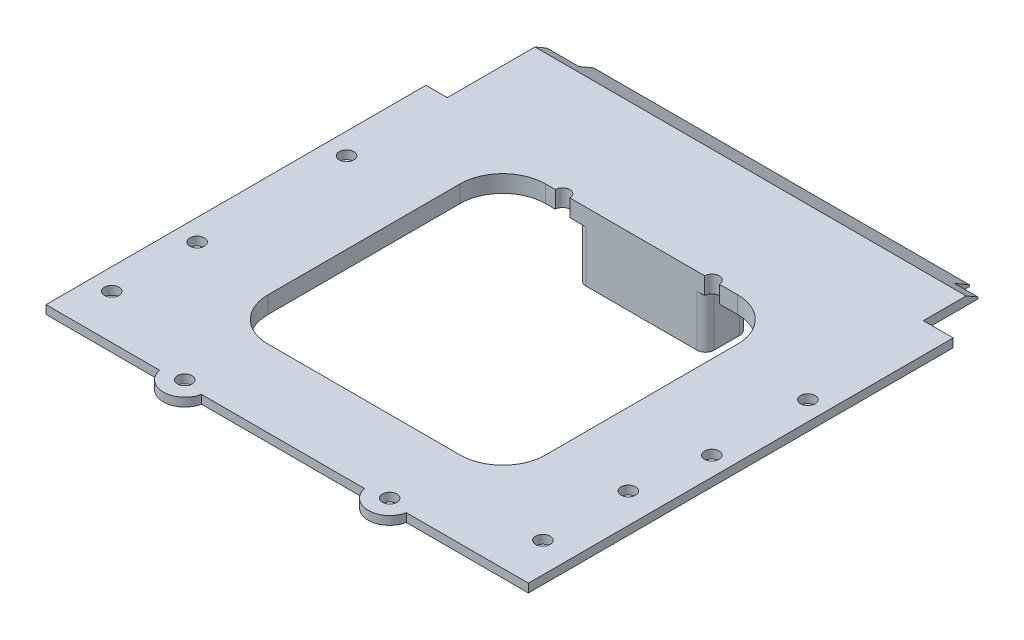
from build123d import *

# Parameters (mm, degrees)
SKETCH_1_W               = 113
SKETCH_1_H               = 113
EXTRUDE_1_DEPTH          = 3
CUT_EXTRUDE_1_REACH      = 161.834
SKETCH_2_R               = 1.7
SKETCH_3_W               = 90
SKETCH_3_H               = 105
EXTRUDE_2_DEPTH          = 2
SKETCH_5_R               = 5
EXTRUDE_3_DEPTH          = 3
CUT_EXTRUDE_2_REACH      = 161.834
SKETCH_6_R               = 1.7
CUT_EXTRUDE_3_REACH      = 161.834
SKETCH_7_R               = 1.7
CUT_EXTRUDE_4_REACH      = 161.884
SKETCH_8_R               = 1.7
EXTRUDE_5_DEPTH          = 90
CUT_EXTRUDE_5_DEPTH      = 2
SKETCH_13_W              = 2
SKETCH_13_H              = 12
EXTRUDE_6_DEPTH          = 11.5
CUT_EXTRUDE_6_REACH      = 162.612
SKETCH_14_R              = 1.7
CUT_EXTRUDE_7_REACH      = 164.681
EXTRUDE_7_DEPTH          = 8.5
SKETCH_17_W              = 2
SKETCH_17_H              = 11.5
EXTRUDE_8_DEPTH          = 3
FILLET_1_R               = 1
CUT_EXTRUDE_8_DEPTH      = 163.681089759
SKETCH_20_W              = 113
SKETCH_20_H              = 12.124355653
CUT_EXTRUDE_9_DEPTH      = 1
CHAMFER_1_SIZE           = 1
SKETCH_21_W              = 7
SKETCH_21_H              = 13.5
CUT_EXTRUDE_10_DEPTH     = 163.681089759
SKETCH_22_W              = 5
SKETCH_22_H              = 24
CUT_EXTRUDE_11_DEPTH     = 163.681089759
SKETCH_23_W              = 2
SKETCH_23_H              = 19.464101615
CUT_EXTRUDE_12_DEPTH     = 2
CUT_EXTRUDE_START        = -2
CUT_EXTRUDE_13_OUTLINE_W = 93
CUT_EXTRUDE_13_OUTLINE_H = 1.228718708
CUT_EXTRUDE_13_DEPTH     = 2
SKETCH_25_W              = 0.692820323
SKETCH_25_H              = 0.4
CUT_EXTRUDE_14_DEPTH     = 5.5
SKETCH_26_W              = 0.692820323
SKETCH_26_H              = 0.4
CUT_EXTRUDE_15_DEPTH     = 7.5
SKETCH_27_W              = 113
SKETCH_27_H              = 105.875644347
CUT_EXTRUDE_16_DEPTH     = 163.339889035
SKETCH_29_W              = 10
SKETCH_29_H              = 5
CUT_EXTRUDE_17_DEPTH     = 163.185818036
SKETCH_30_W              = 10
SKETCH_30_H              = 2
CUT_EXTRUDE_18_DEPTH     = 37
SKETCH_31_W              = 10
SKETCH_31_H              = 27
EXTRUDE_9_DEPTH          = 1
CUT_EXTRUDE_19_REACH     = 164.056
SKETCH_32_W              = 65
SKETCH_32_H              = 65
SKETCH_33_W              = 30
SKETCH_33_H              = 10
EXTRUDE_10_DEPTH         = 12
EXTRUDE_11_DEPTH         = 12
EXTRUDE_START            = -4
EXTRUDE_11_2_OUTLINE_W   = 10
EXTRUDE_11_2_OUTLINE_H   = 7
EXTRUDE_11_2_DEPTH       = 4


# Read off the part's stored shape, not the designer's step: 切除-拉伸13, 凸台-拉伸11
with BuildPart() as part:
    # 草图1 → 凸台-拉伸1 (new body)
    with BuildSketch(Plane(origin=(0, 0, 0), x_dir=(1, 0, 0), z_dir=(0, 1, 0))):
        with Locations((56.5, 56.5)):
            Rectangle(SKETCH_1_W, SKETCH_1_H)
    extrude(amount=EXTRUDE_1_DEPTH)

    # 草图2 → 切除-拉伸1 (cut, up to next)
    with BuildSketch(Plane(origin=(0, 3, 0), x_dir=(1, 0, 0), z_dir=(0, 1, 0)), mode=Mode.PRIVATE) as cut_extrude_1_sk1:
        with Locations(Location((108.5, 69.95, 0), (0, 0, 270))):
            Circle(SKETCH_2_R)
    cut_extrude_1_tool1 = extrude(cut_extrude_1_sk1.sketch, amount=-CUT_EXTRUDE_1_REACH, mode=Mode.PRIVATE) & part.part
    # 草图2 → 切除-拉伸1 (cut, up to next)
    with BuildSketch(Plane(origin=(0, 3, 0), x_dir=(1, 0, 0), z_dir=(0, 1, 0)), mode=Mode.PRIVATE) as cut_extrude_1_sk2:
        with Locations(Location((108.5, 47.45, 0), (0, 0, 270))):
            Circle(SKETCH_2_R)
    cut_extrude_1_tool2 = extrude(cut_extrude_1_sk2.sketch, amount=-CUT_EXTRUDE_1_REACH, mode=Mode.PRIVATE) & part.part
    # 草图2 → 切除-拉伸1 (cut, up to next)
    with BuildSketch(Plane(origin=(0, 3, 0), x_dir=(1, 0, 0), z_dir=(0, 1, 0)), mode=Mode.PRIVATE) as cut_extrude_1_sk3:
        with Locations(Location((106, 30.4, 0), (0, 0, 270))):
            Circle(SKETCH_2_R)
    cut_extrude_1_tool3 = extrude(cut_extrude_1_sk3.sketch, amount=-CUT_EXTRUDE_1_REACH, mode=Mode.PRIVATE) & part.part
    # 草图2 → 切除-拉伸1 (cut, up to next)
    with BuildSketch(Plane(origin=(0, 3, 0), x_dir=(1, 0, 0), z_dir=(0, 1, 0)), mode=Mode.PRIVATE) as cut_extrude_1_sk4:
        with Locations(Location((106, 10.4, 0), (0, 0, 270))):
            Circle(SKETCH_2_R)
    cut_extrude_1_tool4 = extrude(cut_extrude_1_sk4.sketch, amount=-CUT_EXTRUDE_1_REACH, mode=Mode.PRIVATE) & part.part
    add(cut_extrude_1_tool1.solids().sort_by_distance((108.5, 3, -69.95))[0], mode=Mode.SUBTRACT)
    add(cut_extrude_1_tool2.solids().sort_by_distance((108.5, 3, -47.45))[0], mode=Mode.SUBTRACT)
    add(cut_extrude_1_tool3.solids().sort_by_distance((106, 3, -30.4))[0], mode=Mode.SUBTRACT)
    add(cut_extrude_1_tool4.solids().sort_by_distance((106, 3, -10.4))[0], mode=Mode.SUBTRACT)

    # 草图3 → 凸台-拉伸2 (add)
    with BuildSketch(Plane(origin=(0, 0, 0), x_dir=(1, 0, 0), z_dir=(0, 1, 0))):
        with Locations((55.5, 60.5)):
            Rectangle(SKETCH_3_W, SKETCH_3_H)
    extrude(amount=-EXTRUDE_2_DEPTH)

    # 草图5 → 凸台-拉伸3 (add)
    with BuildSketch(Plane.XZ):
        with Locations((79.5, -1)):
            Circle(SKETCH_5_R)
        with Locations((31.5, -1)):
            Circle(SKETCH_5_R)
    extrude(amount=-EXTRUDE_3_DEPTH)

    # 草图6 → 切除-拉伸2 (cut, up to next)
    with BuildSketch(Plane.XZ, mode=Mode.PRIVATE) as cut_extrude_2_sk1:
        with Locations(Location((31.5, -1, 0), (0, 0, 270))):
            Circle(SKETCH_6_R)
    cut_extrude_2_tool1 = extrude(cut_extrude_2_sk1.sketch, amount=-CUT_EXTRUDE_2_REACH, mode=Mode.PRIVATE) & part.part
    # 草图6 → 切除-拉伸2 (cut, up to next)
    with BuildSketch(Plane.XZ, mode=Mode.PRIVATE) as cut_extrude_2_sk2:
        with Locations(Location((79.5, -1, 0), (0, 0, 270))):
            Circle(SKETCH_6_R)
    cut_extrude_2_tool2 = extrude(cut_extrude_2_sk2.sketch, amount=-CUT_EXTRUDE_2_REACH, mode=Mode.PRIVATE) & part.part
    add(cut_extrude_2_tool1.solids().sort_by_distance((31.5, 0, -1))[0], mode=Mode.SUBTRACT)
    add(cut_extrude_2_tool2.solids().sort_by_distance((79.5, 0, -1))[0], mode=Mode.SUBTRACT)

    # 草图7 → 切除-拉伸3 (cut, up to next)
    with BuildSketch(Plane.XZ, mode=Mode.PRIVATE) as cut_extrude_3_sk1:
        with Locations(Location((5, -10.4, 0), (0, 0, 270))):
            Circle(SKETCH_7_R)
    cut_extrude_3_tool1 = extrude(cut_extrude_3_sk1.sketch, amount=-CUT_EXTRUDE_3_REACH, mode=Mode.PRIVATE) & part.part
    # 草图7 → 切除-拉伸3 (cut, up to next)
    with BuildSketch(Plane.XZ, mode=Mode.PRIVATE) as cut_extrude_3_sk2:
        with Locations(Location((5, -30.4, 0), (0, 0, 270))):
            Circle(SKETCH_7_R)
    cut_extrude_3_tool2 = extrude(cut_extrude_3_sk2.sketch, amount=-CUT_EXTRUDE_3_REACH, mode=Mode.PRIVATE) & part.part
    # 草图7 → 切除-拉伸3 (cut, up to next)
    with BuildSketch(Plane.XZ, mode=Mode.PRIVATE) as cut_extrude_3_sk3:
        with Locations(Location((5, -65.4, 0), (0, 0, 270))):
            Circle(SKETCH_7_R)
    cut_extrude_3_tool3 = extrude(cut_extrude_3_sk3.sketch, amount=-CUT_EXTRUDE_3_REACH, mode=Mode.PRIVATE) & part.part
    add(cut_extrude_3_tool1.solids().sort_by_distance((5, 0, -10.4))[0], mode=Mode.SUBTRACT)
    add(cut_extrude_3_tool2.solids().sort_by_distance((5, 0, -30.4))[0], mode=Mode.SUBTRACT)
    add(cut_extrude_3_tool3.solids().sort_by_distance((5, 0, -65.4))[0], mode=Mode.SUBTRACT)

    # 草图8 → 切除-拉伸4 (cut, up to next)
    with BuildSketch(Plane.XZ.offset(2), mode=Mode.PRIVATE) as cut_extrude_4_sk1:
        with Locations(Location((38, -83, 0), (0, 0, 270))):
            Circle(SKETCH_8_R)
    cut_extrude_4_tool1 = extrude(cut_extrude_4_sk1.sketch, amount=-CUT_EXTRUDE_4_REACH, mode=Mode.PRIVATE) & part.part
    # 草图8 → 切除-拉伸4 (cut, up to next)
    with BuildSketch(Plane.XZ.offset(2), mode=Mode.PRIVATE) as cut_extrude_4_sk2:
        with Locations(Location((73, -83, 0), (0, 0, 270))):
            Circle(SKETCH_8_R)
    cut_extrude_4_tool2 = extrude(cut_extrude_4_sk2.sketch, amount=-CUT_EXTRUDE_4_REACH, mode=Mode.PRIVATE) & part.part
    add(cut_extrude_4_tool1.solids().sort_by_distance((38, -2, -83))[0], mode=Mode.SUBTRACT)
    add(cut_extrude_4_tool2.solids().sort_by_distance((73, -2, -83))[0], mode=Mode.SUBTRACT)

    # 草图10 → 凸台-拉伸5 (add)
    with BuildSketch(Plane(origin=(100.5, 0, 0), x_dir=(0, 0, -1), z_dir=(1, 0, 0))):
        Polygon((113, 0), (116.464101615, -2), (113, -2), align=None)
    extrude(amount=-EXTRUDE_5_DEPTH)

    # 草图11 → 切除-拉伸5 (cut)
    with BuildSketch(Plane(origin=(0, -2, 0), x_dir=(1, 0, 0), z_dir=(0, 1, 0))):
        with BuildLine():
            Line((33, 83), (33, 53))
            ThreePointArc((33, 53), (38, 48), (43, 53))
            Line((43, 53), (43, 83))
            ThreePointArc((43, 83), (38, 88), (33, 83))
        make_face()
        with BuildLine():
            Line((68, 83), (68, 53))
            ThreePointArc((68, 53), (73, 48), (78, 53))
            Line((78, 53), (78, 83))
            ThreePointArc((78, 83), (73, 88), (68, 83))
        make_face()
    extrude(amount=CUT_EXTRUDE_5_DEPTH, mode=Mode.SUBTRACT)

    # 草图13 → 凸台-拉伸6 (add)
    with BuildSketch(Plane.XZ):
        with Locations((4, -83)):
            Rectangle(SKETCH_13_W, SKETCH_13_H)
    extrude(amount=EXTRUDE_6_DEPTH)

    # 草图14 → 切除-拉伸6 (cut, up to next)
    with BuildSketch(Plane.ZY.offset(-3), mode=Mode.PRIVATE) as cut_extrude_6_sk1:
        with Locations((-83.5, -5)):
            Circle(SKETCH_14_R)
    cut_extrude_6_tool1 = extrude(cut_extrude_6_sk1.sketch, amount=-CUT_EXTRUDE_6_REACH, mode=Mode.PRIVATE) & part.part
    add(cut_extrude_6_tool1.solids().sort_by_distance((3, -5, -83.5))[0], mode=Mode.SUBTRACT)

    # 草图15 → 切除-拉伸7 (cut, up to next)
    with BuildSketch(Plane.XZ, mode=Mode.PRIVATE) as cut_extrude_7_sk1:
        Polygon((113, -100.875644347), (106, -113), (113, -113), align=None)
    cut_extrude_7_tool1 = extrude(cut_extrude_7_sk1.sketch, amount=-CUT_EXTRUDE_7_REACH, mode=Mode.PRIVATE) & part.part
    add(cut_extrude_7_tool1.solids().sort_by_distance((110.666667, 0, -108.958548))[0], mode=Mode.SUBTRACT)

    # 草图16 → 凸台-拉伸7 (add)
    with BuildSketch(Plane.XZ):
        Polygon((113, -99.5), (107.5, -99.5), (107.5, -110.401923789), (113, -100.875644347), align=None)
    extrude(amount=EXTRUDE_7_DEPTH)

    # 草图17 → 凸台-拉伸8 (add)
    with BuildSketch(Plane.ZY.offset(-3)):
        with Locations((-78, -5.75)):
            Rectangle(SKETCH_17_W, SKETCH_17_H)
    extrude(amount=EXTRUDE_8_DEPTH)

    # 圆角1
    fillet_1_edges = [part.edges().sort_by_distance(p)[0] for p in [
        (3, -5.75, -79),
    ]]
    fillet(fillet_1_edges, radius=FILLET_1_R)

    # 草图19 → 切除-拉伸8 (cut, through all)
    with BuildSketch(Plane.ZY):
        Polygon((-113, 0), (-107.803847577, 3), (-113, 3), align=None)
    extrude(amount=-CUT_EXTRUDE_8_DEPTH, mode=Mode.SUBTRACT)

    # 草图20 → 切除-拉伸9 (cut)
    with BuildSketch(Plane(origin=(0, 3, 0), x_dir=(1, 0, 0), z_dir=(0, 1, 0))):
        with Locations((56.5, 106.937822173)):
            Rectangle(SKETCH_20_W, SKETCH_20_H)
    extrude(amount=-CUT_EXTRUDE_9_DEPTH, mode=Mode.SUBTRACT)

    # 倒角1
    chamfer_1_edges = [part.edges().sort_by_distance(p)[0] for p in [
        (56.5, 2, -100.875644347),
    ]]
    chamfer(chamfer_1_edges, length=CHAMFER_1_SIZE - 0.0001)  # a hair under: the kernel refuses the full size

    # 草图21 → 切除-拉伸10 (cut, through all)
    with BuildSketch(Plane.XZ.offset(8.5)):
        with Locations((109.5, -106.25)):
            Rectangle(SKETCH_21_W, SKETCH_21_H)
    extrude(amount=-CUT_EXTRUDE_10_DEPTH, mode=Mode.SUBTRACT)

    # 草图22 → 切除-拉伸11 (cut, through all)
    with BuildSketch(Plane.XZ):
        with Locations((2.5, -101)):
            Rectangle(SKETCH_22_W, SKETCH_22_H)
    extrude(amount=-CUT_EXTRUDE_11_DEPTH, mode=Mode.SUBTRACT)

    # 草图23 → 切除-拉伸12 (cut)
    with BuildSketch(Plane.XZ.offset(2)):
        with Locations((11.5, -106.732050808)):
            Rectangle(SKETCH_23_W, SKETCH_23_H)
    extrude(amount=-CUT_EXTRUDE_12_DEPTH, mode=Mode.SUBTRACT)

    # 切除-拉伸13 outline → 切除-拉伸13 (cut)
    with BuildSketch(Plane(origin=(0, 0, 0), x_dir=(1, 0, 0), z_dir=(0, 1, 0)).offset(CUT_EXTRUDE_START)):
        Polygon((9.5, 94), (12.5, 97), (9, 97), (9, 94), align=None)
        with Locations((55.5, 116.385640646)):
            Rectangle(CUT_EXTRUDE_13_OUTLINE_W, CUT_EXTRUDE_13_OUTLINE_H)
    extrude(amount=CUT_EXTRUDE_13_DEPTH, mode=Mode.SUBTRACT)

    # 草图25 → 切除-拉伸14 (cut)
    with BuildSketch(Plane(origin=(106, 0, 0), x_dir=(0, 0, -1), z_dir=(1, 0, 0))):
        with Locations((112.653589839, 0.2)):
            Rectangle(SKETCH_25_W, SKETCH_25_H)
    extrude(amount=-CUT_EXTRUDE_14_DEPTH, mode=Mode.SUBTRACT)

    # 草图26 → 切除-拉伸15 (cut)
    with BuildSketch(Plane.ZY.offset(-5)):
        with Locations((-112.653589839, 0.2)):
            Rectangle(SKETCH_26_W, SKETCH_26_H)
    extrude(amount=-CUT_EXTRUDE_15_DEPTH, mode=Mode.SUBTRACT)

    # 草图27 → 切除-拉伸16 (cut, through all)
    with BuildSketch(Plane(origin=(0, 2, 0), x_dir=(1, 0, 0), z_dir=(0, 1, 0))):
        with Locations((56.5, 48.937822174)):
            Rectangle(SKETCH_27_W, SKETCH_27_H)
    extrude(amount=CUT_EXTRUDE_16_DEPTH, mode=Mode.SUBTRACT)

    # 草图29 → 切除-拉伸17 (cut, through all)
    with BuildSketch(Plane.XZ):
        with Locations((38, -50.5)):
            Rectangle(SKETCH_29_W, SKETCH_29_H)
        with Locations((73, -50.5)):
            Rectangle(SKETCH_29_W, SKETCH_29_H)
    extrude(amount=CUT_EXTRUDE_17_DEPTH, mode=Mode.SUBTRACT)

    # 草图30 → 切除-拉伸18 (cut)
    with BuildSketch(Plane(origin=(0, 0, -48), x_dir=(-1, 0, 0), z_dir=(0, 0, -1))):
        with Locations((-38, -1)):
            Rectangle(SKETCH_30_W, SKETCH_30_H)
        with Locations((-73, -1)):
            Rectangle(SKETCH_30_W, SKETCH_30_H)
    extrude(amount=-CUT_EXTRUDE_18_DEPTH, mode=Mode.SUBTRACT)

    # 草图31 → 凸台-拉伸9 (add)
    with BuildSketch(Plane.XZ):
        with Locations((38, -24.5)):
            Rectangle(SKETCH_31_W, SKETCH_31_H)
        with Locations((73, -24.5)):
            Rectangle(SKETCH_31_W, SKETCH_31_H)
    extrude(amount=EXTRUDE_9_DEPTH)

    # 草图32 → 切除-拉伸19 (cut, up to next)
    with BuildSketch(Plane.XZ.offset(2), mode=Mode.PRIVATE) as cut_extrude_19_sk1:
        with Locations((56.5, -50.5)):
            Rectangle(SKETCH_32_W, SKETCH_32_H)
    cut_extrude_19_tool1 = extrude(cut_extrude_19_sk1.sketch, amount=-CUT_EXTRUDE_19_REACH, mode=Mode.PRIVATE) & part.part
    add(cut_extrude_19_tool1.solids().sort_by_distance((56.5, -2, -50.5))[0], mode=Mode.SUBTRACT)

    # 草图33 → 凸台-拉伸10 (add)
    with BuildSketch(Plane.XZ.offset(2)):
        with Locations((56.5, -88)):
            Rectangle(SKETCH_33_W, SKETCH_33_H)
    extrude(amount=EXTRUDE_10_DEPTH)

    # 凸台-拉伸11 outline → 凸台-拉伸11 (cut)
    with BuildSketch(Plane.XZ.offset(2)):
        with BuildLine():
            Line((71.5, -83), (69.5, -83))
            ThreePointArc((69.5, -83), (70.914213562, -83.585786438), (71.5, -85))
            Line((71.5, -85), (71.5, -83))
        make_face()
        with BuildLine():
            Line((43.5, -83), (41.5, -83))
            Line((41.5, -83), (41.5, -85))
            ThreePointArc((41.5, -85), (42.085786438, -83.585786438), (43.5, -83))
        make_face()
        with BuildLine():
            Line((71.5, -93), (71.5, -91))
            ThreePointArc((71.5, -91), (70.914213562, -92.414213562), (69.5, -93))
            Line((69.5, -93), (71.5, -93))
        make_face()
        with BuildLine():
            Line((41.5, -93), (43.5, -93))
            ThreePointArc((43.5, -93), (42.085786438, -92.414213562), (41.5, -91))
            Line((41.5, -91), (41.5, -93))
        make_face()
    extrude(amount=EXTRUDE_11_DEPTH, mode=Mode.SUBTRACT)

    # Extrude 11 2 outline → Extrude 11 2 (add)
    with BuildSketch(Plane.XZ.offset(2).offset(EXTRUDE_START)):
        with BuildLine():
            Line((71.3, -83), (68, -83))
            ThreePointArc((68, -83), (73, -88), (78, -83))
            Line((78, -83), (74.7, -83))
            ThreePointArc((74.7, -83), (73, -84.7), (71.3, -83))
        make_face()
        with BuildLine():
            ThreePointArc((89, -73), (86.071067812, -80.071067812), (79, -83))
            Line((79, -83), (89, -83))
            Line((89, -83), (89, -73))
        make_face()
        with BuildLine():
            Line((43, -83), (39.7, -83))
            ThreePointArc((39.7, -83), (38, -84.7), (36.3, -83))
            Line((36.3, -83), (34, -83))
            ThreePointArc((34, -83), (26.928932188, -80.071067812), (24, -73))
            Line((24, -73), (24, -83))
            Line((24, -83), (33, -83))
            ThreePointArc((33, -83), (38, -88), (43, -83))
        make_face()
        with BuildLine():
            ThreePointArc((79, -18), (86.071067812, -20.928932188), (89, -28))
            Line((89, -28), (89, -18))
            Line((89, -18), (79, -18))
        make_face()
        with Locations((73, -14.5)):
            Rectangle(EXTRUDE_11_2_OUTLINE_W, EXTRUDE_11_2_OUTLINE_H)
        with BuildLine():
            Line((24, -18), (24, -28))
            ThreePointArc((24, -28), (26.928932188, -20.928932188), (34, -18))
            Line((34, -18), (43, -18))
            Line((43, -18), (43, -11))
            Line((43, -11), (33, -11))
            Line((33, -11), (33, -18))
            Line((33, -18), (24, -18))
        make_face()
    extrude(amount=EXTRUDE_11_2_DEPTH)


solid = part.part
